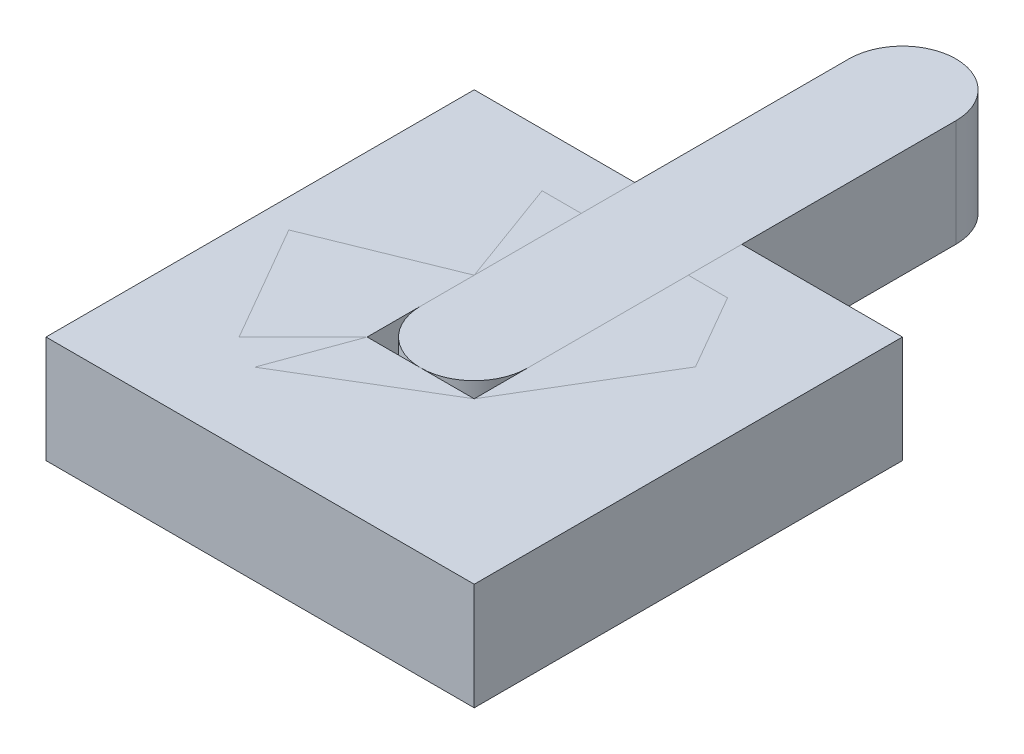
from build123d import *

# Parameters (mm, degrees)
BASE_FLANGE1_DEPTH = 2.3
SKETCH6_W          = 9.2
SKETCH6_H          = 9.2
BASE_FLANGE2_DEPTH = 2.3
SKETCH9_W          = 2.3
SKETCH9_H          = 2.3
CUT_EXTRUDE1_DEPTH = 2.3
BASE_FLANGE3_DEPTH = 2.3
SKETCH13_W         = 2.3
SKETCH13_H         = 2.3
CUT_EXTRUDE2_DEPTH = 12.557356964


# Sheet-metal steps are written as plain solids
with BuildPart() as part:
    # Sketch1 → Base-Flange1 (new body)
    with BuildSketch(Plane(origin=(0, 0, 0), x_dir=(1, 0, 0), z_dir=(0, 1, 0))):
        with BuildLine():
            Line((-1.15, 0), (-1.15, 9.2))
            ThreePointArc((-1.15, 9.2), (0, 10.35), (1.15, 9.2))
            Line((1.15, 9.2), (1.15, 0))
            ThreePointArc((1.15, 0), (0, -1.15), (-1.15, 0))
        make_face()
    extrude(amount=-BASE_FLANGE1_DEPTH)


with BuildPart() as body_2:
    # Sketch6 → Base-Flange2 (new body)
    with BuildSketch(Plane(origin=(0, 0, 0), x_dir=(1, 0, 0), z_dir=(0, 1, 0))):
        Rectangle(SKETCH6_W, SKETCH6_H)
    extrude(amount=-BASE_FLANGE2_DEPTH)

    # Sketch9 → Cut-Extrude1 (cut)
    with BuildSketch(Plane(origin=(0, 0, 0), x_dir=(1, 0, 0), z_dir=(0, 1, 0))):
        Rectangle(SKETCH9_W, SKETCH9_H)
    extrude(amount=-CUT_EXTRUDE1_DEPTH, mode=Mode.SUBTRACT)


with BuildPart() as body_3:
    # Sketch10 → Base-Flange3 (new body)
    with BuildSketch(Plane(origin=(0, 0, 0), x_dir=(1, 0, 0), z_dir=(0, 1, 0))):
        Polygon((3.983716857, 0), (1.991858429, 3.45), (-1.991858429, 3.45), (-3.983716857, 0), (-1.991858429, -3.45), (1.991858429, -3.45), align=None)
    extrude(amount=-BASE_FLANGE3_DEPTH)

    # Sketch13 → Cut-Extrude2 (cut, through all)
    with BuildSketch(Plane(origin=(0, 0, 0), x_dir=(1, 0, 0), z_dir=(0, 1, 0))):
        Rectangle(SKETCH13_W, SKETCH13_H)
    extrude(amount=-CUT_EXTRUDE2_DEPTH, mode=Mode.SUBTRACT)


solid = Compound([part.part, body_2.part, body_3.part])
